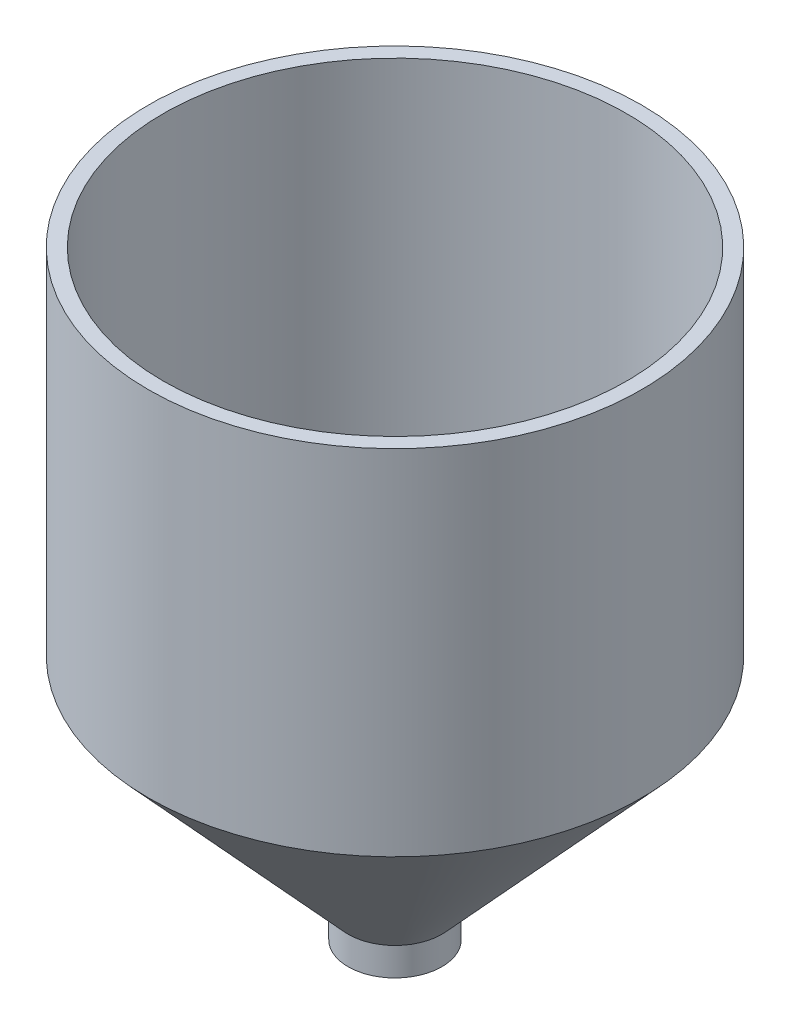
from build123d import *

# Parameters (mm, degrees)
CROQUIS1_R              = 52.6
SALIENTE_EXTRUIR1_DEPTH = 75.4
CROQUIS3_R              = 10
CROQUIS2_R              = 52.6
CROQUIS4_R              = 10
SALIENTE_EXTRUIR2_DEPTH = 30
CROQUIS7_R              = 17.5
CORTAR_EXTRUIR2_DEPTH   = 24


# Read off the part's stored shape, not the designer's step: Vaciado2
with BuildPart() as part:
    # Croquis1 → Saliente-Extruir1 (new body)
    with BuildSketch(Plane(origin=(0, 0, 0), x_dir=(1, 0, 0), z_dir=(0, 1, 0))):
        with Locations(Location((0, 0, 0), (0, 0, 270))):
            Circle(CROQUIS1_R)
    extrude(amount=-SALIENTE_EXTRUIR1_DEPTH)

    # Croquis3 → Recubrir1 section 0
    with BuildSketch(Plane(origin=(0, -121.9, 0), x_dir=(1, 0, 0), z_dir=(0, 1, 0))):
        Circle(CROQUIS3_R)
    # Croquis2 → Recubrir1 section 1
    with BuildSketch(Plane.XZ.offset(75.4)):
        Circle(CROQUIS2_R)
    loft()

    # Croquis4 → Saliente-Extruir2 (add)
    with BuildSketch(Plane.XZ.offset(121.9)):
        with Locations(Location((0, 0, 0), (0, 0, 270))):
            Circle(CROQUIS4_R)
    extrude(amount=SALIENTE_EXTRUIR2_DEPTH)

    # Croquis7 → Cortar-Extruir2 (cut)
    with BuildSketch(Plane.XZ.offset(151.9)):
        Circle(CROQUIS7_R)
    extrude(amount=-CORTAR_EXTRUIR2_DEPTH, mode=Mode.SUBTRACT)

    # Vaciado2 outline → Vaciado2 (revolve, cut)
    with BuildSketch(Plane.XY):
        Polygon((0, -127.9), (6.825, -127.9), (6.825, -120.665510856), (49.425, -74.165510856), (49.425, 0), (0, 0), align=None)
    revolve(axis=Axis((0, 0, 0), (0, 1, 0)), mode=Mode.SUBTRACT)


solid = part.part
